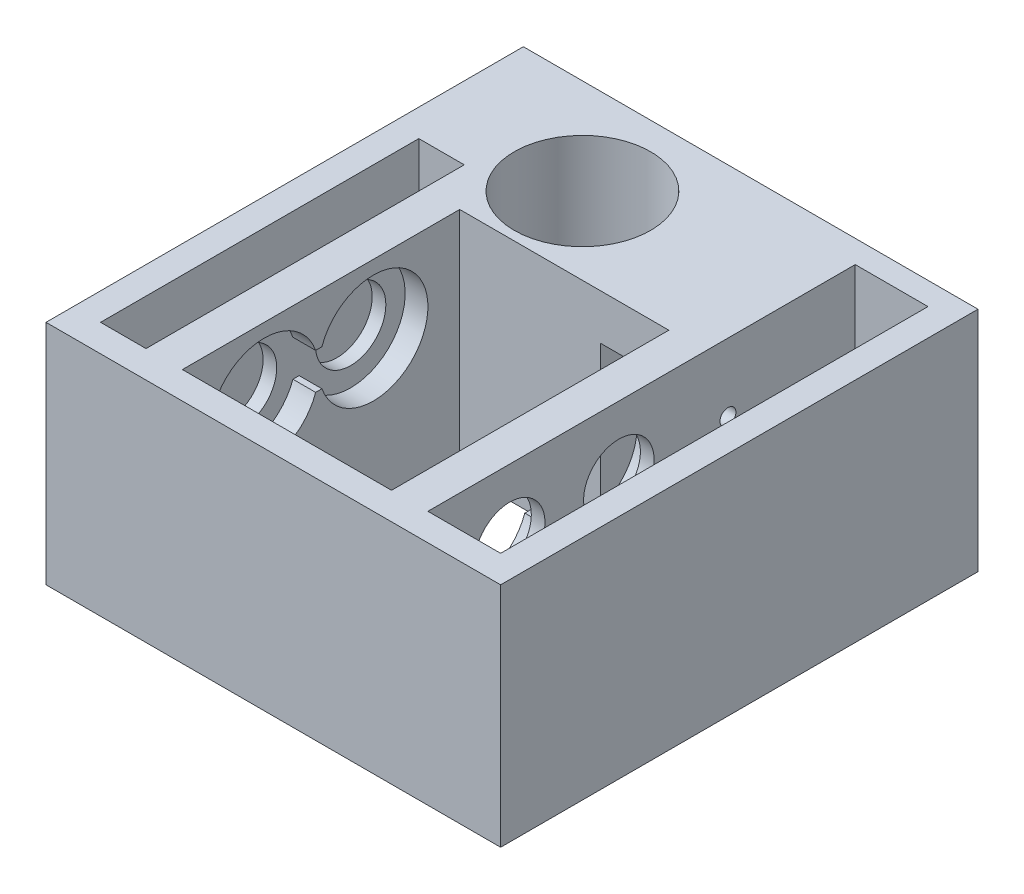
from build123d import *

# Parameters (mm, degrees)
SKETCH2_W           = 100
SKETCH2_H           = 105
BOSS_EXTRUDE1_DEPTH = 50
CUT_EXTRUDE1_REACH  = 90.07
SKETCH3_R           = 15
CUT_EXTRUDE3_REACH  = 90.07
SKETCH5_W           = 16
SKETCH5_H           = 80
SKETCH5_W_2         = 10
SKETCH5_H_2         = 70
CUT_EXTRUDE4_DEPTH  = 31
SKETCH7_R           = 7.75
BOSS_EXTRUDE2_DEPTH = 3
CUT_EXTRUDE7_REACH  = 90.07
SKETCH11_W          = 16
SKETCH11_H          = 14
CUT_EXTRUDE5_REACH  = 90.07
SKETCH8_W           = 46
SKETCH8_H           = 61
SKETCH9_R           = 1.75
CUT_EXTRUDE8_DEPTH  = 3
SKETCH13_W          = 20
SKETCH13_H          = 19
CUT_EXTRUDE9_DEPTH  = 40


with BuildPart() as part:
    # Sketch2 → Boss-Extrude1 (new body)
    with BuildSketch(Plane(origin=(0, 0, 0), x_dir=(1, 0, 0), z_dir=(0, 1, 0))):
        Rectangle(SKETCH2_W, SKETCH2_H)
    extrude(amount=BOSS_EXTRUDE1_DEPTH)

    # Sketch3 → Cut-Extrude1 (cut, up to next)
    with BuildSketch(Plane(origin=(0, 50, 0), x_dir=(1, 0, 0), z_dir=(0, 1, 0)), mode=Mode.PRIVATE) as cut_extrude1_sk1:
        with Locations((-16.005435425, 31.5)):
            Circle(SKETCH3_R)
    cut_extrude1_tool1 = extrude(cut_extrude1_sk1.sketch, amount=-CUT_EXTRUDE1_REACH, mode=Mode.PRIVATE) & part.part
    add(cut_extrude1_tool1.solids().sort_by_distance((-16.005435, 50, -31.5))[0], mode=Mode.SUBTRACT)

    # Sketch5 → Cut-Extrude3 (cut, up to next)
    with BuildSketch(Plane(origin=(0, 50, 0), x_dir=(1, 0, 0), z_dir=(0, 1, 0)), mode=Mode.PRIVATE) as cut_extrude3_sk1:
        with Locations((36, -6.5)):
            Rectangle(SKETCH5_W, SKETCH5_H)
    cut_extrude3_tool1 = extrude(cut_extrude3_sk1.sketch, amount=-CUT_EXTRUDE3_REACH, mode=Mode.PRIVATE) & part.part
    # Sketch5 → Cut-Extrude3 (cut, up to next)
    with BuildSketch(Plane(origin=(0, 50, 0), x_dir=(1, 0, 0), z_dir=(0, 1, 0)), mode=Mode.PRIVATE) as cut_extrude3_sk2:
        with Locations((-39, -11.5)):
            Rectangle(SKETCH5_W_2, SKETCH5_H_2)
    cut_extrude3_tool2 = extrude(cut_extrude3_sk2.sketch, amount=-CUT_EXTRUDE3_REACH, mode=Mode.PRIVATE) & part.part
    add(cut_extrude3_tool1.solids().sort_by_distance((36, 50, 6.5))[0], mode=Mode.SUBTRACT)
    add(cut_extrude3_tool2.solids().sort_by_distance((-39, 50, 11.5))[0], mode=Mode.SUBTRACT)

    # Sketch6 → Cut-Extrude4 (cut)
    with BuildSketch(Plane(origin=(28, 0, 0), x_dir=(0, 0, -1), z_dir=(1, 0, 0))):
        with BuildLine():
            Line((-17.186291501, 39), (-15.813708499, 39))
            ThreePointArc((-15.813708499, 39), (7.5, 35), (-15.813708499, 31))
            Line((-15.813708499, 31), (-17.186291501, 31))
            ThreePointArc((-17.186291501, 31), (-40.5, 35), (-17.186291501, 39))
        make_face()
    cut_extrude4 = extrude(amount=-CUT_EXTRUDE4_DEPTH, mode=Mode.SUBTRACT)

    # Sketch7 → Boss-Extrude2 (add)
    with BuildSketch(Plane(origin=(28, 0, 0), x_dir=(0, 0, -1), z_dir=(1, 0, 0))):
        with BuildLine():
            Line((-17.186291501, 31), (-15.813708499, 31))
            ThreePointArc((-15.813708499, 31), (7.5, 35), (-15.813708499, 39))
            Line((-15.813708499, 39), (-17.186291501, 39))
            ThreePointArc((-17.186291501, 39), (-40.5, 35), (-17.186291501, 31))
        make_face()
        with Locations((-28.5, 35)):
            Circle(SKETCH7_R, mode=Mode.SUBTRACT)
        with Locations((-4.5, 35)):
            Circle(SKETCH7_R, mode=Mode.SUBTRACT)
    boss_extrude2 = extrude(amount=-BOSS_EXTRUDE2_DEPTH)

    # Mirror1: Cut-Extrude4, Boss-Extrude2 across plane
    add(cut_extrude4.mirror(Plane(origin=(-3, 0, 0), x_dir=(0, 0, 1), z_dir=(1, 0, 0))), mode=Mode.SUBTRACT)
    add(boss_extrude2.mirror(Plane(origin=(-3, 0, 0), x_dir=(0, 0, 1), z_dir=(1, 0, 0))))

    # Sketch11 → Cut-Extrude7 (cut, up to next)
    with BuildSketch(Plane(origin=(0, 50, 0), x_dir=(1, 0, 0), z_dir=(0, 1, 0)), mode=Mode.PRIVATE) as cut_extrude7_sk1:
        with Locations((36, 40.5)):
            Rectangle(SKETCH11_W, SKETCH11_H)
    cut_extrude7_tool1 = extrude(cut_extrude7_sk1.sketch, amount=-CUT_EXTRUDE7_REACH, mode=Mode.PRIVATE) & part.part
    add(cut_extrude7_tool1.solids().sort_by_distance((36, 50, -40.5))[0], mode=Mode.SUBTRACT)

    # Sketch8 → Cut-Extrude5 (cut, up to next)
    with BuildSketch(Plane(origin=(0, 50, 0), x_dir=(1, 0, 0), z_dir=(0, 1, 0)), mode=Mode.PRIVATE) as cut_extrude5_sk1:
        with Locations((-3, -16)):
            Rectangle(SKETCH8_W, SKETCH8_H)
    cut_extrude5_tool1 = extrude(cut_extrude5_sk1.sketch, amount=-CUT_EXTRUDE5_REACH, mode=Mode.PRIVATE) & part.part
    add(cut_extrude5_tool1.solids().sort_by_distance((-3, 50, 16))[0], mode=Mode.SUBTRACT)

    # Sketch9 → Cut-Extrude8 (cut)
    with BuildSketch(Plane(origin=(28, 0, 0), x_dir=(0, 0, -1), z_dir=(1, 0, 0))):
        with Locations((19.5, 35)):
            Circle(SKETCH9_R)
    extrude(amount=-CUT_EXTRUDE8_DEPTH, mode=Mode.SUBTRACT)

    # Sketch13 → Cut-Extrude9 (cut)
    with BuildSketch(Plane.XZ):
        with Locations((15, -24)):
            Rectangle(SKETCH13_W, SKETCH13_H)
    extrude(amount=-CUT_EXTRUDE9_DEPTH, mode=Mode.SUBTRACT)


solid = part.part
